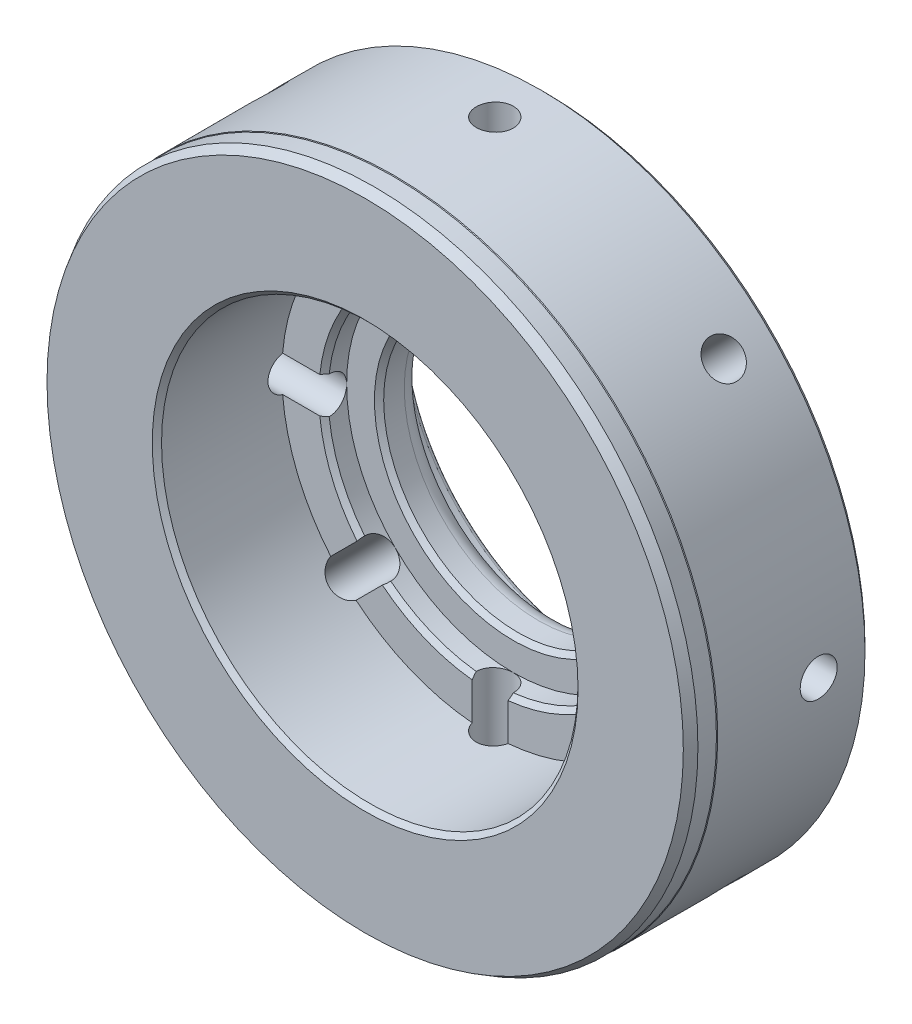
from build123d import *

# Parameters (mm, degrees)
CIRPATTERN1_COUNT = 8


with BuildPart() as part:
    # Sketch1 → Revolve1 (revolve)
    with BuildSketch(Plane(origin=(0, 0, 0), x_dir=(0, 0, -1), z_dir=(1, 0, 0))):
        with BuildLine():
            Line((1, 34.95), (3, 34.95))
            Line((3, 34.95), (3.08660254, 35))
            Line((3.08660254, 35), (19, 35))
            Line((19, 35), (19.5, 34.5))
            Line((19.5, 34.5), (19.5, 26.5))
            Line((19.5, 26.5), (25, 26.5))
            Line((25, 26.5), (25.5, 26))
            Line((25.5, 26), (25.5, 21.5))
            ThreePointArc((25.5, 21.5), (25.353553391, 21.146446609), (25, 21))
            Line((25, 21), (22, 21))
            Line((22, 21), (20.655527926, 15.98236191))
            ThreePointArc((20.655527926, 15.98236191), (19.941199131, 14.913293319), (18.723676273, 14.5))
            Line((18.723676273, 14.5), (16.5, 14.5))
            Line((16.5, 14.5), (16, 15))
            Line((16, 15), (16, 18))
            Line((16, 18), (14, 18))
            Line((14, 18), (13.5, 18.5))
            Line((13.5, 18.5), (13.5, 22.5))
            Line((13.5, 22.5), (0.5, 22.5))
            Line((0.5, 22.5), (0, 23))
            Line((0, 23), (0, 34.372649731))
            Line((0, 34.372649731), (1, 34.95))
        make_face()
    revolve(axis=Axis((0, 0, 0), (0, 0, -1)))

    # Sketch2 → Ø4.0 (4) Diameter Hole1 (revolve, cut)
    with BuildSketch(Plane(origin=(0, 35, -14), x_dir=(0, 0, 1), z_dir=(1, 0, 0))):
        Polygon((0, 0), (0, 26.201721238), (2, 25), (2, 0), align=None)
    f_4_0_4_diameter_hole1 = revolve(axis=Axis((0, 41.35, -14), (0, -1, 0)), mode=Mode.SUBTRACT)

    # CirPattern1: Ø4.0 (4) Diameter Hole1 ×8 about axis
    cirpattern1_axis = Axis((0, 0, 0), (0, 0, 1))
    for i in range(1, CIRPATTERN1_COUNT):
        add(f_4_0_4_diameter_hole1.rotate(cirpattern1_axis, i * 360 / CIRPATTERN1_COUNT), mode=Mode.SUBTRACT)


solid = part.part
